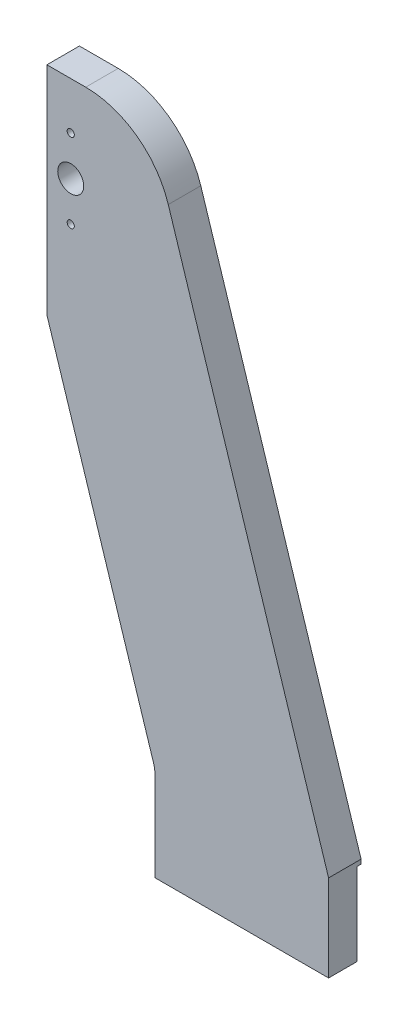
from build123d import *

# Parameters (mm, degrees)
SALIENTE_EXTRUIR1_DEPTH                        = 15
CROQUIS2_R                                     = 6
CORTAR_EXTRUIR1_DEPTH                          = 311.845620847
PERFORADOR_PARA_ROSCAR_PARA_MACHO_DE_ROS_D     = 3.3
PERFORADOR_PARA_ROSCAR_PARA_MACHO_DE_ROS_DEPTH = 7
PERFORADOR_PARA_ROSCAR_PARA_MACHO_DE_ROS_TIP   = 0.991420021
CROQUIS9_W                                     = 80
CROQUIS9_H                                     = 38
CORTAR_EXTRUIR2_DEPTH                          = 2
PERFORADOR_PARA_ROSCAR_PARA_MACHO_DE_2_D       = 3.3
PERFORADOR_PARA_ROSCAR_PARA_MACHO_DE_2_DEPTH   = 15
PERFORADOR_PARA_ROSCAR_PARA_MACHO_DE_2_TIP     = 0.991420021
TALADROS_DE_ESPIGA_DE_4_0MM1_D                 = 4
TALADROS_DE_ESPIGA_DE_4_0MM1_DEPTH             = 17
TALADROS_DE_ESPIGA_DE_4_0MM1_TIP               = 1.201721238


with BuildPart() as part:
    # Croquis1 → Saliente-Extruir1 (new body)
    with BuildSketch(Plane.XY):
        with BuildLine():
            Line((80, 0), (80, 40))
            Line((80, 40), (6.016406662, 272.145884266))
            ThreePointArc((6.016406662, 272.145884266), (-8.492384821, 292.294236101), (-32.094976092, 300))
            Line((-32.094976092, 300), (-50, 300))
            Line((-50, 300), (-50, 200))
            Line((-50, 200), (-0.944308623, 46.072942133))
            ThreePointArc((-0.944308623, 46.072942133), (-0.23748716, 43.0729605), (0, 40))
            Line((0, 40), (0, 0))
            Line((0, 0), (80, 0))
        make_face()
    extrude(amount=SALIENTE_EXTRUIR1_DEPTH)

    # Croquis2 → Cortar-Extruir1 (cut, through all)
    with BuildSketch(Plane(origin=(0, 0, 0), x_dir=(-1, 0, 0), z_dir=(0, 0, -1))):
        with Locations((39, 260)):
            Circle(CROQUIS2_R)
    extrude(amount=-CORTAR_EXTRUIR1_DEPTH, mode=Mode.SUBTRACT)

    # Perforador para roscar para macho de ros
    with Locations(Plane.XY.offset(15)):
        with Locations((-39, 278.25), (-39, 241.75)):
            Hole(PERFORADOR_PARA_ROSCAR_PARA_MACHO_DE_ROS_D / 2, depth=PERFORADOR_PARA_ROSCAR_PARA_MACHO_DE_ROS_DEPTH)
            with Locations((0, 0, -(PERFORADOR_PARA_ROSCAR_PARA_MACHO_DE_ROS_DEPTH + PERFORADOR_PARA_ROSCAR_PARA_MACHO_DE_ROS_TIP / 2))):  # 118° drill point
                Cone(0, PERFORADOR_PARA_ROSCAR_PARA_MACHO_DE_ROS_D / 2, PERFORADOR_PARA_ROSCAR_PARA_MACHO_DE_ROS_TIP, mode=Mode.SUBTRACT)

    # Croquis9 → Cortar-Extruir2 (cut)
    with BuildSketch(Plane(origin=(0, 0, 0), x_dir=(-1, 0, 0), z_dir=(0, 0, -1))):
        with Locations((-40, 19)):
            Rectangle(CROQUIS9_W, CROQUIS9_H)
    extrude(amount=-CORTAR_EXTRUIR2_DEPTH, mode=Mode.SUBTRACT)

    # Perforador para roscar para macho de 2
    with Locations(Plane.ZY.offset(50)):
        with Locations((9, 285), (9, 235)):
            Hole(PERFORADOR_PARA_ROSCAR_PARA_MACHO_DE_2_D / 2, depth=PERFORADOR_PARA_ROSCAR_PARA_MACHO_DE_2_DEPTH)
            with Locations((0, 0, -(PERFORADOR_PARA_ROSCAR_PARA_MACHO_DE_2_DEPTH + PERFORADOR_PARA_ROSCAR_PARA_MACHO_DE_2_TIP / 2))):  # 118° drill point
                Cone(0, PERFORADOR_PARA_ROSCAR_PARA_MACHO_DE_2_D / 2, PERFORADOR_PARA_ROSCAR_PARA_MACHO_DE_2_TIP, mode=Mode.SUBTRACT)

    # Taladros de espiga de Ø4.0mm1
    with Locations(Plane.ZY.offset(50)):
        with Locations((9, 274), (9, 246)):
            Hole(TALADROS_DE_ESPIGA_DE_4_0MM1_D / 2, depth=TALADROS_DE_ESPIGA_DE_4_0MM1_DEPTH)
            with Locations((0, 0, -(TALADROS_DE_ESPIGA_DE_4_0MM1_DEPTH + TALADROS_DE_ESPIGA_DE_4_0MM1_TIP / 2))):  # 118° drill point
                Cone(0, TALADROS_DE_ESPIGA_DE_4_0MM1_D / 2, TALADROS_DE_ESPIGA_DE_4_0MM1_TIP, mode=Mode.SUBTRACT)


solid = part.part
